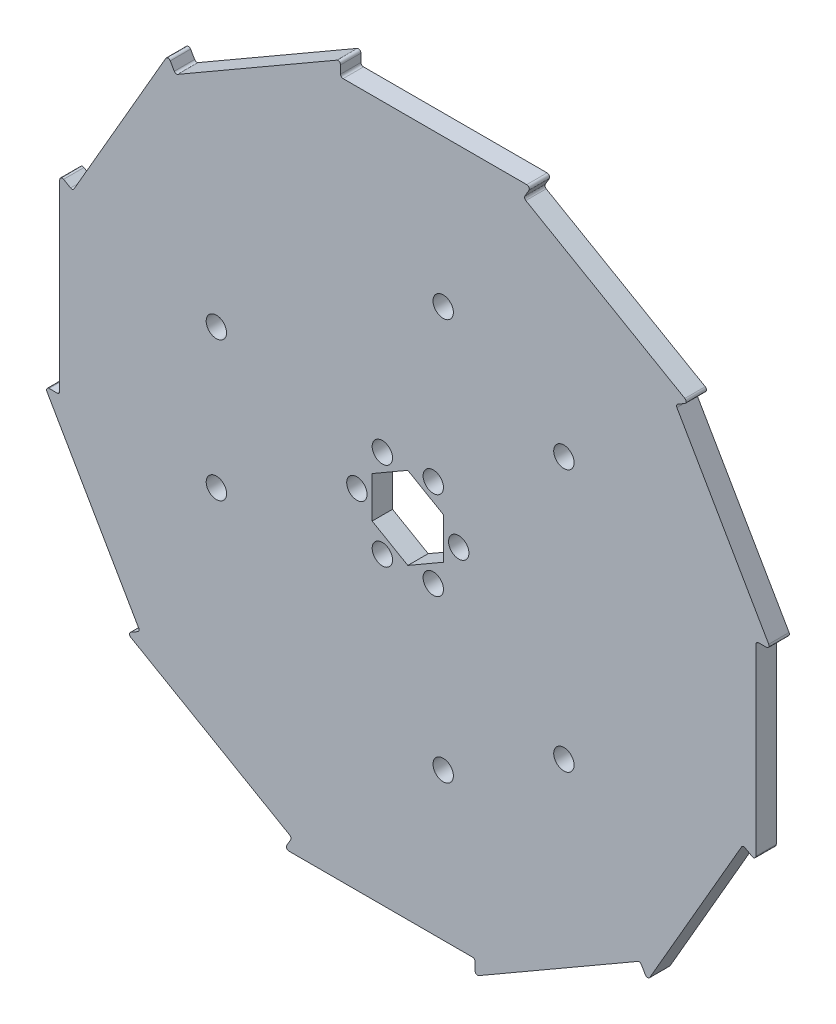
from build123d import *

# Parameters (mm, degrees)
SKETCH1_R           = 2
BOSS_EXTRUDE1_DEPTH = 4


with BuildPart() as part:
    # Sketch1 → Boss-Extrude1 (new body)
    with BuildSketch(Plane.XY):
        with BuildLine():
            Line((45.85012117, -53.014735727), (46.64249454, -54.387166664))
            ThreePointArc((46.64249454, -54.387166664), (47.075507242, -54.637166664), (47.508519944, -54.387166664))
            Line((47.508519944, -54.387166664), (59.181723965, -34.168584212))
            Line((59.181723965, -34.168584212), (65.531724861, -23.170060032))
            ThreePointArc((65.531724861, -23.170060032), (65.835328041, -22.937097119), (66.214737563, -22.98704733))
            Line((66.214737563, -22.98704733), (67.5871685, -23.779420701))
            ThreePointArc((67.5871685, -23.779420701), (68.0871685, -23.779420701), (68.3371685, -23.346407999))
            Line((68.3371685, -23.346407999), (68.3371685, 4.4e-08))
            Line((68.3371685, 4.4e-08), (68.3371685, 12.700001836))
            ThreePointArc((68.3371685, 12.700001836), (68.483615109, 13.053555226), (68.8371685, 13.200001836))
            Line((68.8371685, 13.200001836), (70.421915241, 13.200001836))
            ThreePointArc((70.421915241, 13.200001836), (70.854927943, 13.450001836), (70.854927943, 13.950001836))
            Line((70.854927943, 13.950001836), (59.181723921, 34.168584288))
            Line((59.181723921, 34.168584288), (52.831723025, 45.167108468))
            ThreePointArc((52.831723025, 45.167108468), (52.781772814, 45.54651799), (53.014735727, 45.85012117))
            Line((53.014735727, 45.85012117), (54.387166664, 46.64249454))
            ThreePointArc((54.387166664, 46.64249454), (54.637166664, 47.075507242), (54.387166664, 47.508519944))
            Line((54.387166664, 47.508519944), (34.168584212, 59.181723965))
            Line((34.168584212, 59.181723965), (23.170060032, 65.531724861))
            ThreePointArc((23.170060032, 65.531724861), (22.937097119, 65.835328041), (22.98704733, 66.214737563))
            Line((22.98704733, 66.214737563), (23.779420701, 67.5871685))
            ThreePointArc((23.779420701, 67.5871685), (23.779420701, 68.0871685), (23.346407999, 68.3371685))
            Line((23.346407999, 68.3371685), (-4.4e-08, 68.3371685))
            Line((-4.4e-08, 68.3371685), (-12.700001836, 68.3371685))
            ThreePointArc((-12.700001836, 68.3371685), (-13.053555226, 68.483615109), (-13.200001836, 68.8371685))
            Line((-13.200001836, 68.8371685), (-13.200001836, 70.421915241))
            ThreePointArc((-13.200001836, 70.421915241), (-13.450001836, 70.854927943), (-13.950001836, 70.854927943))
            Line((-13.950001836, 70.854927943), (-34.168584288, 59.181723921))
            Line((-34.168584288, 59.181723921), (-45.167108468, 52.831723025))
            ThreePointArc((-45.167108468, 52.831723025), (-45.54651799, 52.781772814), (-45.85012117, 53.014735727))
            Line((-45.85012117, 53.014735727), (-46.64249454, 54.387166664))
            ThreePointArc((-46.64249454, 54.387166664), (-47.075507242, 54.637166664), (-47.508519944, 54.387166664))
            Line((-47.508519944, 54.387166664), (-59.181723965, 34.168584212))
            Line((-59.181723965, 34.168584212), (-65.531724861, 23.170060032))
            ThreePointArc((-65.531724861, 23.170060032), (-65.835328041, 22.937097119), (-66.214737563, 22.98704733))
            Line((-66.214737563, 22.98704733), (-67.5871685, 23.779420701))
            ThreePointArc((-67.5871685, 23.779420701), (-68.0871685, 23.779420701), (-68.3371685, 23.346407999))
            Line((-68.3371685, 23.346407999), (-68.3371685, -4.4e-08))
            Line((-68.3371685, -4.4e-08), (-68.3371685, -12.700001836))
            ThreePointArc((-68.3371685, -12.700001836), (-68.483615109, -13.053555226), (-68.8371685, -13.200001836))
            Line((-68.8371685, -13.200001836), (-70.421915241, -13.200001836))
            ThreePointArc((-70.421915241, -13.200001836), (-70.854927943, -13.450001836), (-70.854927943, -13.950001836))
            Line((-70.854927943, -13.950001836), (-59.181723921, -34.168584288))
            Line((-59.181723921, -34.168584288), (-52.831723025, -45.167108468))
            ThreePointArc((-52.831723025, -45.167108468), (-52.781772814, -45.54651799), (-53.014735727, -45.85012117))
            Line((-53.014735727, -45.85012117), (-54.387166664, -46.64249454))
            ThreePointArc((-54.387166664, -46.64249454), (-54.637166664, -47.075507242), (-54.387166664, -47.508519944))
            Line((-54.387166664, -47.508519944), (-34.168584212, -59.181723965))
            Line((-34.168584212, -59.181723965), (-23.170060032, -65.531724861))
            ThreePointArc((-23.170060032, -65.531724861), (-22.937097119, -65.835328041), (-22.98704733, -66.214737563))
            Line((-22.98704733, -66.214737563), (-23.779420701, -67.5871685))
            ThreePointArc((-23.779420701, -67.5871685), (-23.779420701, -68.0871685), (-23.346407999, -68.3371685))
            Line((-23.346407999, -68.3371685), (4.4e-08, -68.3371685))
            Line((4.4e-08, -68.3371685), (12.700001836, -68.3371685))
            ThreePointArc((12.700001836, -68.3371685), (13.053555226, -68.483615109), (13.200001836, -68.8371685))
            Line((13.200001836, -68.8371685), (13.200001836, -70.421915241))
            ThreePointArc((13.200001836, -70.421915241), (13.450001836, -70.854927943), (13.950001836, -70.854927943))
            Line((13.950001836, -70.854927943), (34.168584288, -59.181723921))
            Line((34.168584288, -59.181723921), (45.167108468, -52.831723025))
            ThreePointArc((45.167108468, -52.831723025), (45.54651799, -52.781772814), (45.85012117, -53.014735727))
        make_face()
        with Locations((-37.587704831, 13.680805733)):
            Circle(SKETCH1_R, mode=Mode.SUBTRACT)
        with Locations((30.641777725, 25.711504387)):
            Circle(SKETCH1_R, mode=Mode.SUBTRACT)
        with Locations((-37.587704831, -13.680805733)):
            Circle(SKETCH1_R, mode=Mode.SUBTRACT)
        with Locations((6.945927107, -39.39231012)):
            Circle(SKETCH1_R, mode=Mode.SUBTRACT)
        with Locations((30.641777725, -25.711504387)):
            Circle(SKETCH1_R, mode=Mode.SUBTRACT)
        with Locations((6.945927107, 39.39231012)):
            Circle(SKETCH1_R, mode=Mode.SUBTRACT)
        with Locations((4.999999994, 8.660254041)):
            Circle(SKETCH1_R, mode=Mode.SUBTRACT)
        with Locations((-10, -6e-09)):
            Circle(SKETCH1_R, mode=Mode.SUBTRACT)
        with Locations((5.000000006, -8.660254035)):
            Circle(SKETCH1_R, mode=Mode.SUBTRACT)
        with Locations((-5.000000006, 8.660254035)):
            Circle(SKETCH1_R, mode=Mode.SUBTRACT)
        with Locations((-4.999999994, -8.660254041)):
            Circle(SKETCH1_R, mode=Mode.SUBTRACT)
        with Locations((10, 6e-09)):
            Circle(SKETCH1_R, mode=Mode.SUBTRACT)
        Polygon((0, 8.082903769), (7, 4.041451884), (7, -4.041451884), (0, -8.082903769), (-7, -4.041451884), (-7, 4.041451884), align=None, mode=Mode.SUBTRACT)
    extrude(amount=BOSS_EXTRUDE1_DEPTH)


solid = part.part
